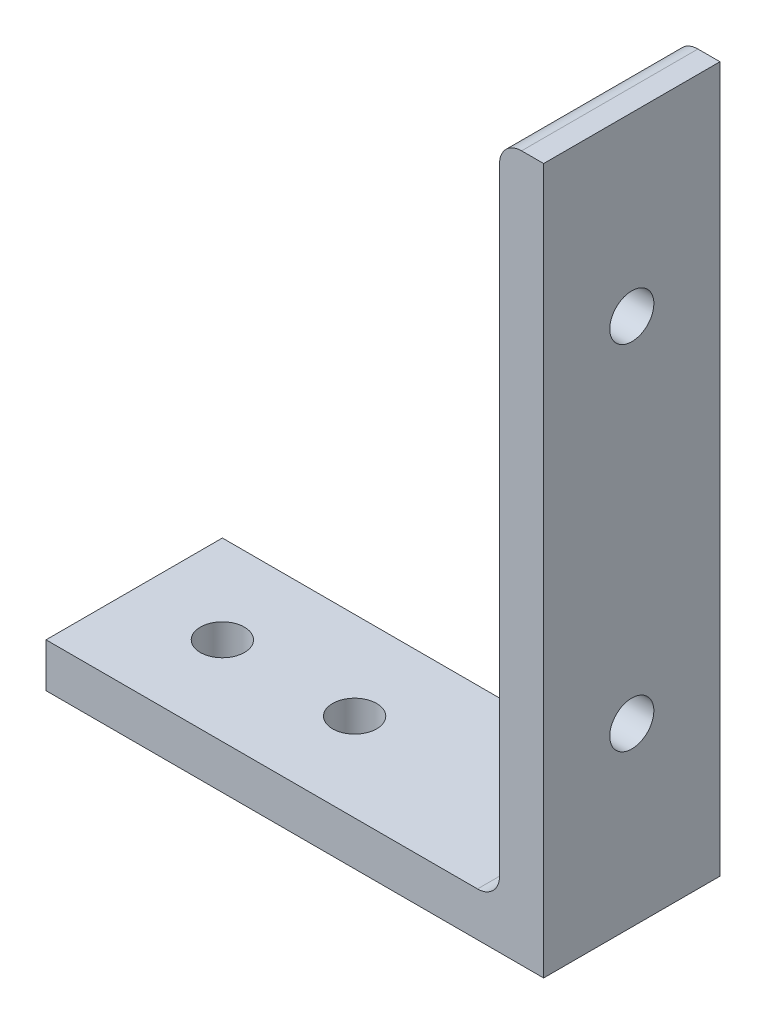
from build123d import *

# Parameters (mm, degrees)
BOSS_EXTRUDE1_DEPTH = 12.7
CUT_EXTRUDE1_REACH  = 129.633
SKETCH3_R           = 3.175
SKETCH4_W           = 28.507373457
SKETCH4_H           = 9.150354521
CUT_EXTRUDE2_DEPTH  = 4.52374
SKETCH5_R           = 3.175
CUT_EXTRUDE3_DEPTH  = 104.370510785


with BuildPart() as part:
    # Sketch2 → Boss-Extrude1 (new, symmetric)
    with BuildSketch(Plane.XY):
        with BuildLine():
            Line((-38.1, 0), (38.1, 0))
            Line((38.1, 0), (38.1, 101.6))
            Line((38.1, 101.6), (34.925, 101.6))
            ThreePointArc((34.925, 101.6), (32.67993597, 100.67006403), (31.75, 98.425))
            Line((31.75, 98.425), (31.75, 9.525))
            ThreePointArc((31.75, 9.525), (30.82006403, 7.27993597), (28.575, 6.35))
            Line((28.575, 6.35), (-34.925, 6.35))
            ThreePointArc((-34.925, 6.35), (-37.17006403, 5.42006403), (-38.1, 3.175))
            Line((-38.1, 3.175), (-38.1, 0))
        make_face()
    extrude(amount=BOSS_EXTRUDE1_DEPTH, both=True)

    # Sketch3 → Cut-Extrude1 (cut, up to next)
    with BuildSketch(Plane(origin=(38.1, 0, 0), x_dir=(0, 0, -1), z_dir=(1, 0, 0)), mode=Mode.PRIVATE) as cut_extrude1_sk1:
        with Locations((0, 76.2)):
            Circle(SKETCH3_R)
    cut_extrude1_tool1 = extrude(cut_extrude1_sk1.sketch, amount=-CUT_EXTRUDE1_REACH, mode=Mode.PRIVATE) & part.part
    # Sketch3 → Cut-Extrude1 (cut, up to next)
    with BuildSketch(Plane(origin=(38.1, 0, 0), x_dir=(0, 0, -1), z_dir=(1, 0, 0)), mode=Mode.PRIVATE) as cut_extrude1_sk2:
        with Locations((0, 25.4)):
            Circle(SKETCH3_R)
    cut_extrude1_tool2 = extrude(cut_extrude1_sk2.sketch, amount=-CUT_EXTRUDE1_REACH, mode=Mode.PRIVATE) & part.part
    add(cut_extrude1_tool1.solids().sort_by_distance((38.1, 76.2, 0))[0], mode=Mode.SUBTRACT)
    add(cut_extrude1_tool2.solids().sort_by_distance((38.1, 25.4, 0))[0], mode=Mode.SUBTRACT)

    # Sketch4 → Cut-Extrude2 (cut)
    with BuildSketch(Plane.ZY.offset(38.1)):
        with Locations((1.553686728, 4.575177261)):
            Rectangle(SKETCH4_W, SKETCH4_H)
    extrude(amount=-CUT_EXTRUDE2_DEPTH, mode=Mode.SUBTRACT)

    # Sketch5 → Cut-Extrude3 (cut, through all)
    with BuildSketch(Plane(origin=(0, 6.35, 0), x_dir=(1, 0, 0), z_dir=(0, 1, 0))):
        with Locations((-1.82626, 0)):
            Circle(SKETCH5_R)
        with Locations((-20.87626, 0)):
            Circle(SKETCH5_R)
    extrude(amount=-CUT_EXTRUDE3_DEPTH, mode=Mode.SUBTRACT)


solid = part.part
